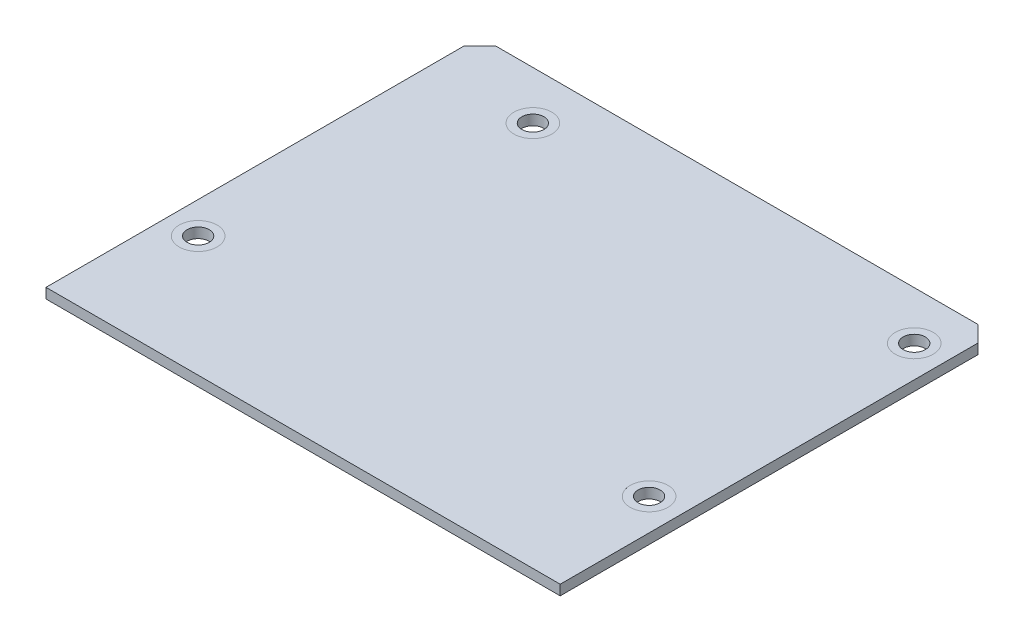
from build123d import *

# Parameters (mm, degrees)
SKETCH1_W           = 81.28
SKETCH1_H           = 68.58
BOSS_EXTRUDE1_DEPTH = 1.6
CHAMFER1_SIZE       = 2.54
CUT_EXTRUDE1_REACH  = 55.197
SKETCH2_R           = 1.75
SKETCH3_R           = 3
CUT_EXTRUDE2_DEPTH  = 0.0001


with BuildPart() as part:
    # Sketch1 → Boss-Extrude1 (new body)
    with BuildSketch(Plane(origin=(0, 0, 0), x_dir=(1, 0, 0), z_dir=(0, 1, 0))):
        Rectangle(SKETCH1_W, SKETCH1_H)
    extrude(amount=BOSS_EXTRUDE1_DEPTH)

    # Chamfer1
    chamfer1_edges = [part.edges().sort_by_distance(p)[0] for p in [
        (40.64, 0.8, -34.29),
        (-40.64, 0.8, -34.29),
    ]]
    chamfer(chamfer1_edges, length=CHAMFER1_SIZE)

    # Sketch2 → Cut-Extrude1 (cut, up to next)
    with BuildSketch(Plane(origin=(0, 1.6, 0), x_dir=(1, 0, 0), z_dir=(0, 1, 0)), mode=Mode.PRIVATE) as cut_extrude1_sk1:
        with Locations((-24.64, 26.67)):
            Circle(SKETCH2_R)
    cut_extrude1_tool1 = extrude(cut_extrude1_sk1.sketch, amount=-CUT_EXTRUDE1_REACH, mode=Mode.PRIVATE) & part.part
    # Sketch2 → Cut-Extrude1 (cut, up to next)
    with BuildSketch(Plane(origin=(0, 1.6, 0), x_dir=(1, 0, 0), z_dir=(0, 1, 0)), mode=Mode.PRIVATE) as cut_extrude1_sk2:
        with Locations((35.64, 26.67)):
            Circle(SKETCH2_R)
    cut_extrude1_tool2 = extrude(cut_extrude1_sk2.sketch, amount=-CUT_EXTRUDE1_REACH, mode=Mode.PRIVATE) & part.part
    # Sketch2 → Cut-Extrude1 (cut, up to next)
    with BuildSketch(Plane(origin=(0, 1.6, 0), x_dir=(1, 0, 0), z_dir=(0, 1, 0)), mode=Mode.PRIVATE) as cut_extrude1_sk3:
        with Locations((35.64, -15.24)):
            Circle(SKETCH2_R)
    cut_extrude1_tool3 = extrude(cut_extrude1_sk3.sketch, amount=-CUT_EXTRUDE1_REACH, mode=Mode.PRIVATE) & part.part
    # Sketch2 → Cut-Extrude1 (cut, up to next)
    with BuildSketch(Plane(origin=(0, 1.6, 0), x_dir=(1, 0, 0), z_dir=(0, 1, 0)), mode=Mode.PRIVATE) as cut_extrude1_sk4:
        with Locations((-35.64, -15.24)):
            Circle(SKETCH2_R)
    cut_extrude1_tool4 = extrude(cut_extrude1_sk4.sketch, amount=-CUT_EXTRUDE1_REACH, mode=Mode.PRIVATE) & part.part
    add(cut_extrude1_tool1.solids().sort_by_distance((-24.64, 1.6, -26.67))[0], mode=Mode.SUBTRACT)
    add(cut_extrude1_tool2.solids().sort_by_distance((35.64, 1.6, -26.67))[0], mode=Mode.SUBTRACT)
    add(cut_extrude1_tool3.solids().sort_by_distance((35.64, 1.6, 15.24))[0], mode=Mode.SUBTRACT)
    add(cut_extrude1_tool4.solids().sort_by_distance((-35.64, 1.6, 15.24))[0], mode=Mode.SUBTRACT)

    # Sketch3 → Cut-Extrude2 (cut)
    with BuildSketch(Plane(origin=(0, 1.6, 0), x_dir=(1, 0, 0), z_dir=(0, 1, 0))):
        with Locations((-24.64, 26.67)):
            Circle(SKETCH3_R)
        with Locations((35.64, 26.67)):
            Circle(SKETCH3_R)
        with Locations((-35.64, -15.24)):
            Circle(SKETCH3_R)
        with Locations((35.64, -15.24)):
            Circle(SKETCH3_R)
    extrude(amount=-CUT_EXTRUDE2_DEPTH, mode=Mode.SUBTRACT)


solid = part.part
